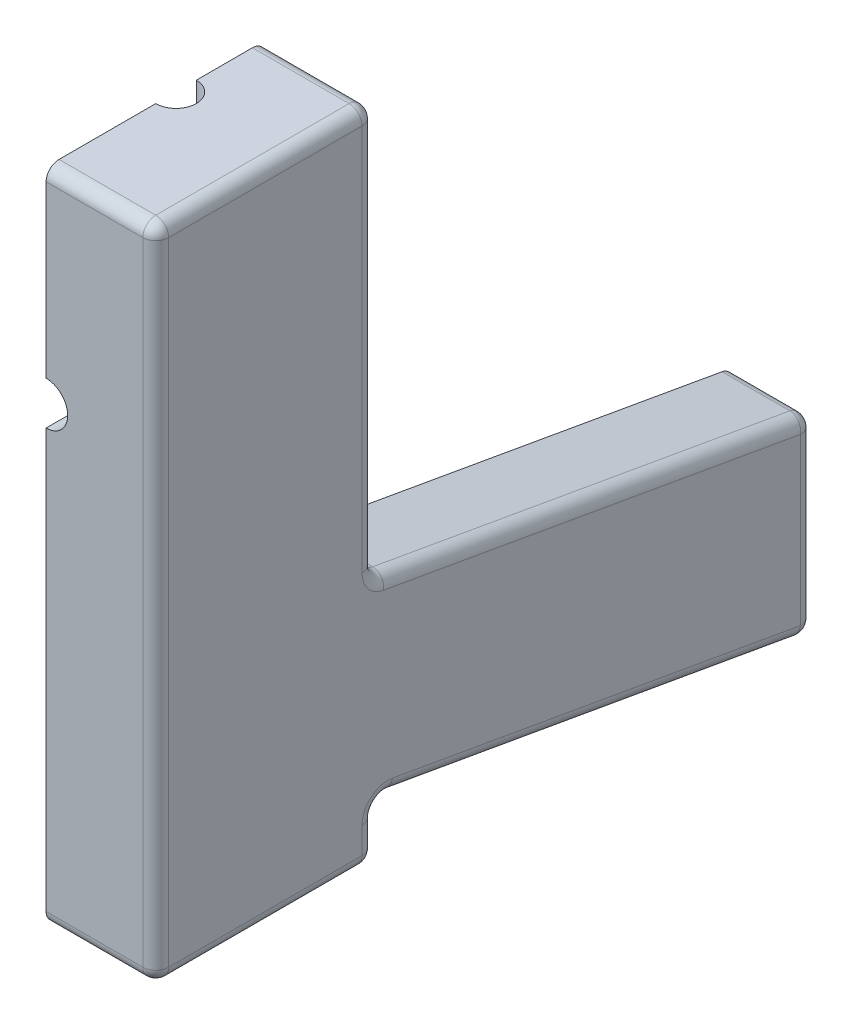
from build123d import *

# Parameters (mm, degrees)
SKETCH1_W           = 25.4
SKETCH1_H           = 50.8
BOSS_EXTRUDE1_DEPTH = 152.4
SKETCH2_W           = 38.1
SKETCH2_H           = 139.7
CUT_EXTRUDE1_DEPTH  = 19.05
HITLED_REACH        = 164.639
IRLED_REACH         = 158.705
SKETCH6_W           = 6.35
SKETCH6_H           = 101.6
BOSS_EXTRUDE2_DEPTH = 6.35
BUTT_DEPTH          = 18.71875
FILLET1_R           = 3


with BuildPart() as part:
    # Sketch1 → Boss-Extrude1 (new body)
    with BuildSketch(Plane(origin=(0, 0, 0), x_dir=(1, 0, 0), z_dir=(0, 1, 0))):
        with Locations((12.7, 25.4)):
            Rectangle(SKETCH1_W, SKETCH1_H)
    extrude(amount=BOSS_EXTRUDE1_DEPTH)

    # Sketch2 → Cut-Extrude1 (cut)
    with BuildSketch(Plane.ZY):
        with Locations((-25.4, 76.2)):
            Rectangle(SKETCH2_W, SKETCH2_H)
    extrude(amount=-CUT_EXTRUDE1_DEPTH, mode=Mode.SUBTRACT)

    # Sketch3 → HitLED (cut, up to next)
    with BuildSketch(Plane.XY, mode=Mode.PRIVATE) as hitled_sk1:
        with BuildLine():
            Line((0, 110), (0, 100))
            ThreePointArc((0, 100), (5, 105), (0, 110))
        make_face()
    hitled_tool1 = extrude(hitled_sk1.sketch, amount=-HITLED_REACH, mode=Mode.PRIVATE) & part.part
    add(hitled_tool1.solids().sort_by_distance((2.122066, 105, 0))[0], mode=Mode.SUBTRACT)

    # Sketch5 → IRLED (cut, up to next)
    with BuildSketch(Plane.XZ.offset(-146.05), mode=Mode.PRIVATE) as irled_sk1:
        with BuildLine():
            Line((0, -25.4), (0, -34.8))
            ThreePointArc((0, -34.8), (4.7, -30.1), (0, -25.4))
        make_face()
    irled_tool1 = extrude(irled_sk1.sketch, amount=-IRLED_REACH, mode=Mode.PRIVATE) & part.part
    add(irled_tool1.solids().sort_by_distance((1.994742, 146.05, -30.1))[0], mode=Mode.SUBTRACT)

    # Sketch6 → Boss-Extrude2 (add)
    with BuildSketch(Plane.ZY.offset(-19.05)):
        with Locations((-30.355, 95.25)):
            Rectangle(SKETCH6_W, SKETCH6_H)
        with Locations((-38.275, 95.25)):
            Rectangle(SKETCH6_W, SKETCH6_H)
    extrude(amount=BOSS_EXTRUDE2_DEPTH)

    # Sketch13 → Butt (add)
    with BuildSketch(Plane(origin=(25.4, 0, -25.4), x_dir=(0, 0, 1), z_dir=(-1, 0, 0))):
        Polygon((-25.4, 57.15), (-25.4, 12.7), (-127, -5.21482124), (-127, 39.23517876), align=None)
    extrude(amount=BUTT_DEPTH)

    # Fillet1
    fillet1_edges = [part.edges().sort_by_distance(p)[0] for p in [
        (16.040625, 12.7, -50.8),
        (16.040625, -5.21482124, -152.4),
        (16.040625, 39.23517876, -152.4),
        (16.040625, 57.15, -50.8),
        (12.7, 152.4, -50.8),
        (12.7, 152.4, 0),
        (25.4, 152.4, -25.4),
        (25.4, 104.775, -50.8),
        (25.4, 48.19258938, -101.6),
        (25.4, 17.01017876, -152.4),
        (25.4, 3.74258938, -101.6),
        (25.4, 6.35, -50.8),
        (12.7, 0, -50.8),
        (12.7, 0, 0),
        (25.4, 0, -25.4),
        (25.4, 76.2, 0),
    ]]
    fillet(fillet1_edges, radius=FILLET1_R)


solid = part.part
